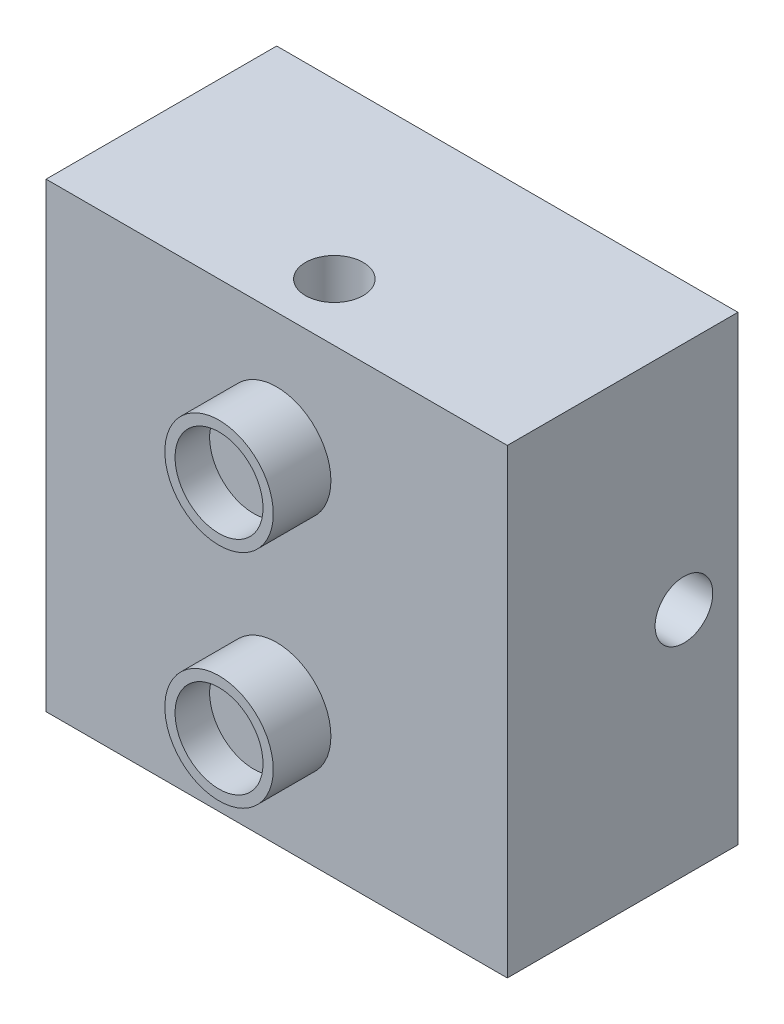
from build123d import *

# Parameters (mm, degrees)
SKETCH1_W           = 101.6
SKETCH1_H           = 101.6
BOSS_EXTRUDE1_DEPTH = 50.8
SKETCH2_R           = 6.35
CUT_EXTRUDE1_DEPTH  = 254
SKETCH3_R           = 6.35
CUT_EXTRUDE2_DEPTH  = 254
SKETCH4_R           = 11.941449671
BOSS_EXTRUDE2_DEPTH = 12.7
SKETCH5_R           = 9.688677572
CUT_EXTRUDE3_DEPTH  = 7.62


with BuildPart() as part:
    # Sketch1 → Boss-Extrude1 (new body)
    with BuildSketch(Plane.XY):
        Rectangle(SKETCH1_W, SKETCH1_H)
    extrude(amount=BOSS_EXTRUDE1_DEPTH)

    # Sketch2 → Cut-Extrude1 (cut)
    with BuildSketch(Plane(origin=(0, 50.8, 0), x_dir=(1, 0, 0), z_dir=(0, 1, 0))):
        with Locations((0, -38.1)):
            Circle(SKETCH2_R)
    extrude(amount=-CUT_EXTRUDE1_DEPTH, mode=Mode.SUBTRACT)

    # Sketch3 → Cut-Extrude2 (cut)
    with BuildSketch(Plane(origin=(50.8, 0, 0), x_dir=(0, 0, -1), z_dir=(1, 0, 0))):
        with Locations((-11.891255669, 0)):
            Circle(SKETCH3_R)
    extrude(amount=-CUT_EXTRUDE2_DEPTH, mode=Mode.SUBTRACT)

    # Sketch4 → Boss-Extrude2 (add)
    with BuildSketch(Plane.XY.offset(50.8)):
        with Locations((0, 24.639024532)):
            Circle(SKETCH4_R)
        with Locations((0, -24.123803476)):
            Circle(SKETCH4_R)
    extrude(amount=BOSS_EXTRUDE2_DEPTH)

    # Sketch5 → Cut-Extrude3 (cut)
    with BuildSketch(Plane.XY.offset(63.5)):
        with Locations((0, 24.639024532)):
            Circle(SKETCH5_R)
        with Locations((0, -24.123803476)):
            Circle(SKETCH5_R)
    extrude(amount=-CUT_EXTRUDE3_DEPTH, mode=Mode.SUBTRACT)


solid = part.part
